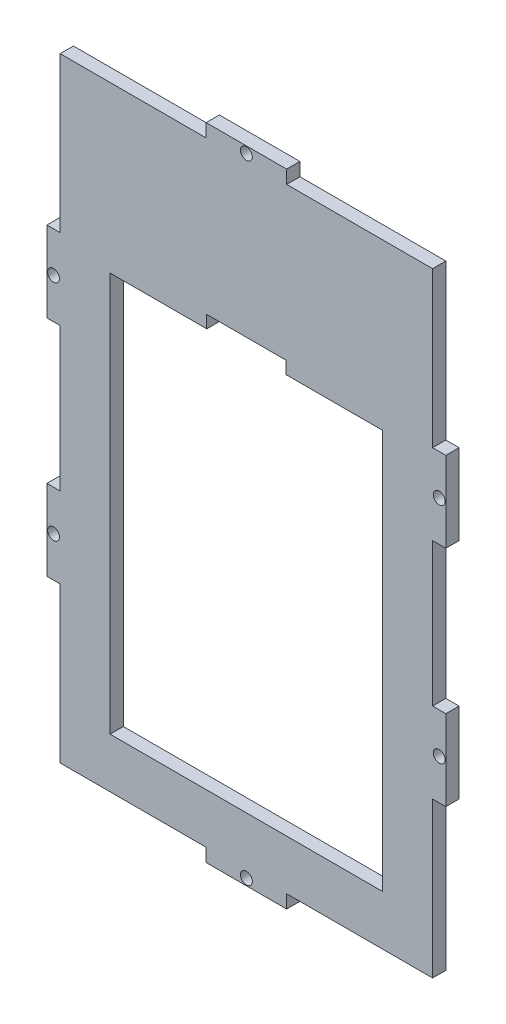
from build123d import *

# Parameters (mm, degrees)
BOSS_EXTRUDE1_DEPTH     = 3.18
CUT_EXTRUDE1_DEPTH      = 87.179315674
SKETCH27_W              = 3.18
SKETCH27_H              = 19.3
BOSS_EXTRUDE9_DEPTH     = 3.18
SKETCH28_W              = 19.3
SKETCH28_H              = 3.18
BOSS_EXTRUDE10_DEPTH    = 3.18
SKETCH29_R              = 1.425
CUT_EXTRUDE14_DEPTH     = 91.550668965
SKETCH30_R              = 1.425
CUT_EXTRUDE15_DEPTH     = 91.550668965
MIRROR9_COPY_1_SKETCH_W = 3.18
MIRROR9_COPY_1_SKETCH_H = 19.3
MIRROR9_COPY_1_DEPTH    = 3.18
MIRROR9_COPY_2_SKETCH_R = 1.425
MIRROR9_COPY_2_DEPTH    = 91.550668965
MIRROR9_COPY_3_SKETCH_W = 3.18
MIRROR9_COPY_3_SKETCH_H = 19.3
MIRROR9_COPY_3_DEPTH    = 3.18
MIRROR9_COPY_4_SKETCH_R = 1.425
MIRROR9_COPY_4_DEPTH    = 91.550668965


with BuildPart() as part:
    # Sketch1 → Boss-Extrude1 (new body)
    with BuildSketch(Plane.XY):
        Polygon((-44.645, 73.645), (-14.881666667, 73.645), (14.881666667, 73.645), (44.645, 73.645), (44.645, -73.645), (-44.645, -73.645), align=None)
    extrude(amount=BOSS_EXTRUDE1_DEPTH)

    # Sketch3 → Cut-Extrude1 (cut, through all)
    with BuildSketch(Plane(origin=(0, 0, 0), x_dir=(-1, 0, 0), z_dir=(0, 0, -1))):
        Polygon((-9.5, 34.075), (-32.675, 34.075), (-32.675, -61.675), (32.675, -61.675), (32.675, 34.075), (9.5, 34.075), (9.5, 37.075), (-9.5, 37.075), align=None)
    extrude(amount=-CUT_EXTRUDE1_DEPTH, mode=Mode.SUBTRACT)

    # Sketch27 → Boss-Extrude9 (add)
    with BuildSketch(Plane.ZY.offset(44.645)):
        with Locations((1.59, -26.825)):
            Rectangle(SKETCH27_W, SKETCH27_H)
    boss_extrude9 = extrude(amount=BOSS_EXTRUDE9_DEPTH)

    # Sketch28 → Boss-Extrude10 (add)
    with BuildSketch(Plane.XZ.offset(73.645)):
        with Locations((0, 1.59)):
            Rectangle(SKETCH28_W, SKETCH28_H)
    boss_extrude10 = extrude(amount=BOSS_EXTRUDE10_DEPTH)

    # Sketch29 → Cut-Extrude14 (cut, through all)
    with BuildSketch(Plane.XY.offset(3.18)):
        with Locations((-46.235, -26.825)):
            Circle(SKETCH29_R)
    cut_extrude14 = extrude(amount=-CUT_EXTRUDE14_DEPTH, mode=Mode.SUBTRACT)

    # Sketch30 → Cut-Extrude15 (cut, through all)
    with BuildSketch(Plane.XY.offset(3.18)):
        with Locations((0, -75.235)):
            Circle(SKETCH30_R)
    cut_extrude15 = extrude(amount=-CUT_EXTRUDE15_DEPTH, mode=Mode.SUBTRACT)

    # Mirror8: Boss-Extrude9, Cut-Extrude14 across plane
    add(boss_extrude9.mirror(Plane(origin=(0, 0, 0), x_dir=(0, 0, 1), z_dir=(1, 0, 0))))
    add(cut_extrude14.mirror(Plane(origin=(0, 0, 0), x_dir=(0, 0, 1), z_dir=(1, 0, 0))), mode=Mode.SUBTRACT)

    # Mirror9: Boss-Extrude10, Cut-Extrude15 across plane
    add(boss_extrude10.mirror(Plane.ZX))
    add(cut_extrude15.mirror(Plane.ZX), mode=Mode.SUBTRACT)

    # Mirror9 copy 1 sketch → Mirror9 copy 1 (add)
    with BuildSketch(Plane(origin=(44.645, 0, 0), x_dir=(0, 0, 1), z_dir=(1, 0, 0))):
        with Locations((1.59, -26.825)):
            Rectangle(MIRROR9_COPY_1_SKETCH_W, MIRROR9_COPY_1_SKETCH_H)
    extrude(amount=MIRROR9_COPY_1_DEPTH)

    # Mirror9 copy 2 sketch → Mirror9 copy 2 (cut, through all)
    with BuildSketch(Plane(origin=(0, 0, 3.18), x_dir=(-1, 0, 0), z_dir=(0, 0, 1))):
        with Locations((-46.235, -26.825)):
            Circle(MIRROR9_COPY_2_SKETCH_R)
    extrude(amount=-MIRROR9_COPY_2_DEPTH, mode=Mode.SUBTRACT)

    # Mirror9 copy 3 sketch → Mirror9 copy 3 (add)
    with BuildSketch(Plane.ZY.offset(44.645)):
        with Locations((1.59, 26.825)):
            Rectangle(MIRROR9_COPY_3_SKETCH_W, MIRROR9_COPY_3_SKETCH_H)
    extrude(amount=MIRROR9_COPY_3_DEPTH)

    # Mirror9 copy 4 sketch → Mirror9 copy 4 (cut, through all)
    with BuildSketch(Plane.XY.offset(3.18)):
        with Locations((-46.235, 26.825)):
            Circle(MIRROR9_COPY_4_SKETCH_R)
    extrude(amount=-MIRROR9_COPY_4_DEPTH, mode=Mode.SUBTRACT)


solid = part.part
